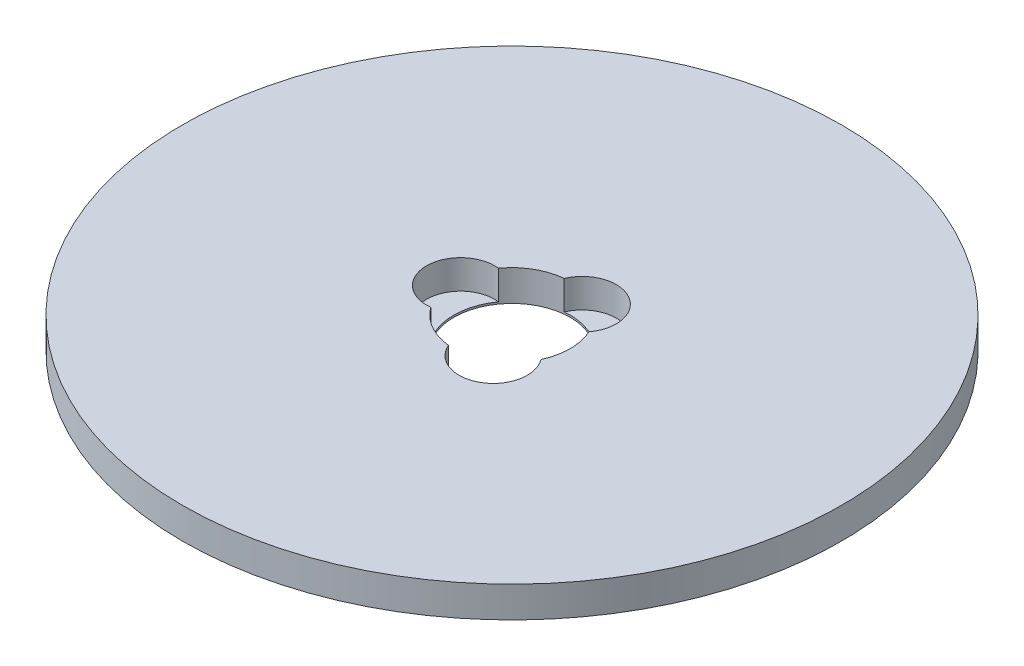
from build123d import *

# Parameters (mm, degrees)
SKETCH1_R           = 85
BOSS_EXTRUDE1_DEPTH = 8
SKETCH2_R           = 15
CUT_EXTRUDE1_DEPTH  = 121.474063599
SKETCH3_R           = 8.789003689
CUT_EXTRUDE2_DEPTH  = 7.49247051
CIRPATTERN1_COUNT   = 3


with BuildPart() as part:
    # Sketch1 → Boss-Extrude1 (new body)
    with BuildSketch(Plane(origin=(0, 0, 0), x_dir=(1, 0, 0), z_dir=(0, 1, 0))):
        Circle(SKETCH1_R)
    extrude(amount=BOSS_EXTRUDE1_DEPTH)

    # Sketch2 → Cut-Extrude1 (cut, through all)
    with BuildSketch(Plane(origin=(0, 0, 0), x_dir=(1, 0, 0), z_dir=(0, 1, 0))):
        Circle(SKETCH2_R)
    extrude(amount=CUT_EXTRUDE1_DEPTH, mode=Mode.SUBTRACT)

    # Sketch3 → Cut-Extrude2 (cut)
    with BuildSketch(Plane(origin=(0, 8, 0), x_dir=(1, 0, 0), z_dir=(0, 1, 0))):
        with Locations((-13.254822843, 0)):
            Circle(SKETCH3_R)
    cut_extrude2 = extrude(amount=-CUT_EXTRUDE2_DEPTH, mode=Mode.SUBTRACT)

    # CirPattern1: Cut-Extrude2 ×3 about axis
    cirpattern1_axis = Axis((0, 0, 0), (0, 1, 0))
    for i in range(1, CIRPATTERN1_COUNT):
        add(cut_extrude2.rotate(cirpattern1_axis, i * 360 / CIRPATTERN1_COUNT), mode=Mode.SUBTRACT)


solid = part.part
